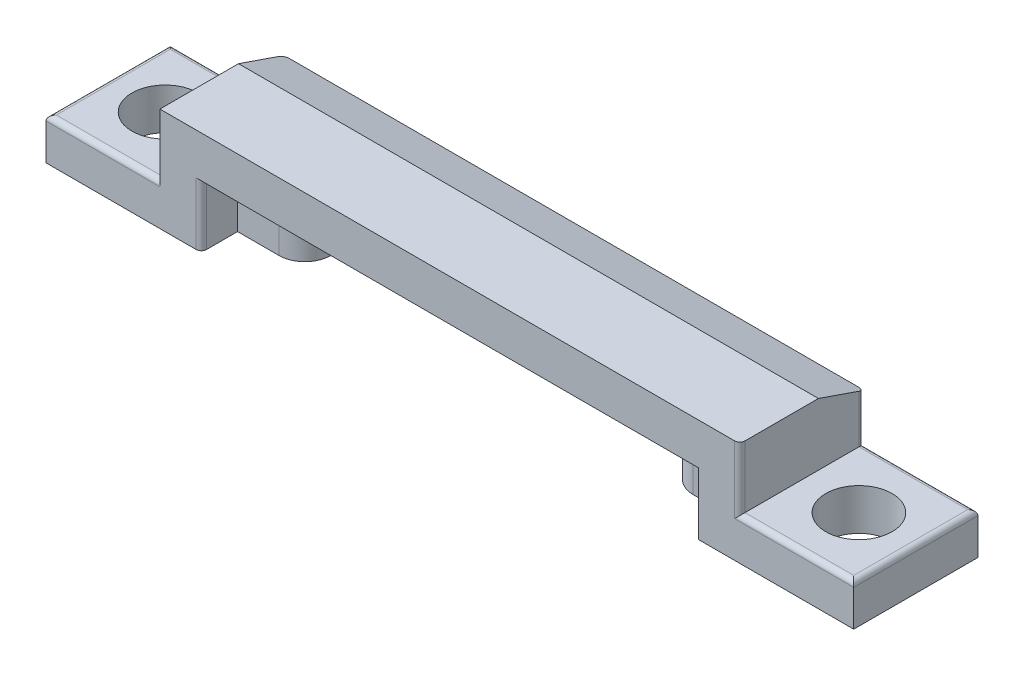
from build123d import *

# Parameters (mm, degrees)
AUFSATZ_LINEAR_AUSTRAGEN1_DEPTH = 6
SKIZZE4_R                       = 1.6
SCHNITT_LINEAR_AUSTRAGEN1_DEPTH = 3
AUFSATZ_LINEAR_AUSTRAGEN2_DEPTH = 3
VERRUNDUNG1_R                   = 0.25
SCHNITT_LINEAR_AUSTRAGEN2_DEPTH = 30


with BuildPart() as part:
    # Skizze1 → Aufsatz-Linear austragen1 (new body)
    with BuildSketch(Plane.XY):
        Polygon((0, 0), (7.5, 0), (7.5, 3), (31.5, 3), (31.5, 0), (39, 0), (39, 2), (33.5, 2), (33.5, 5), (5.5, 5), (5.5, 2), (0, 2), align=None)
    extrude(amount=AUFSATZ_LINEAR_AUSTRAGEN1_DEPTH)

    # Skizze4 → Schnitt-Linear austragen1 (cut)
    with BuildSketch(Plane.XZ):
        with Locations((36.25, 3)):
            Circle(SKIZZE4_R)
    schnitt_linear_austragen1 = extrude(amount=-SCHNITT_LINEAR_AUSTRAGEN1_DEPTH, mode=Mode.SUBTRACT)

    # Skizze12 → Aufsatz-Linear austragen2 (add)
    with BuildSketch(Plane.XZ.offset(-3)):
        with BuildLine():
            Line((31.5, 1.75), (29.5, 1.75))
            ThreePointArc((29.5, 1.75), (28.25, 3), (29.5, 4.25))
            Line((29.5, 4.25), (31.5, 4.25))
            Line((31.5, 4.25), (31.5, 1.75))
        make_face()
    aufsatz_linear_austragen2 = extrude(amount=AUFSATZ_LINEAR_AUSTRAGEN2_DEPTH)

    # Spiegeln3: Aufsatz-Linear austragen2 across plane
    add(aufsatz_linear_austragen2.mirror(Plane.ZY.offset(-19.5)))

    # Spiegeln4: Schnitt-Linear austragen1 across plane
    add(schnitt_linear_austragen1.mirror(Plane.ZY.offset(-19.5)), mode=Mode.SUBTRACT)

    # Verrundung1
    verrundung1_edges = [part.edges().sort_by_distance(p)[0] for p in [
        (7.5, 1.5, 6),
        (33.5, 3.5, 6),
        (33.5, 3.5, 0),
        (5.5, 3.5, 0),
        (2.75, 2, 6),
        (0, 2, 3),
        (2.75, 2, 0),
        (36.25, 2, 0),
        (39, 2, 3),
        (36.25, 2, 6),
    ]]
    fillet(verrundung1_edges, radius=VERRUNDUNG1_R)

    # Skizze13 → Schnitt-Linear austragen2 (cut)
    with BuildSketch(Plane(origin=(33.5, 0, 0), x_dir=(0, 0, -1), z_dir=(1, 0, 0))):
        Polygon((-2.205, 5), (0, 4.24), (0, 5), align=None)
    extrude(amount=-SCHNITT_LINEAR_AUSTRAGEN2_DEPTH, mode=Mode.SUBTRACT)


solid = part.part
